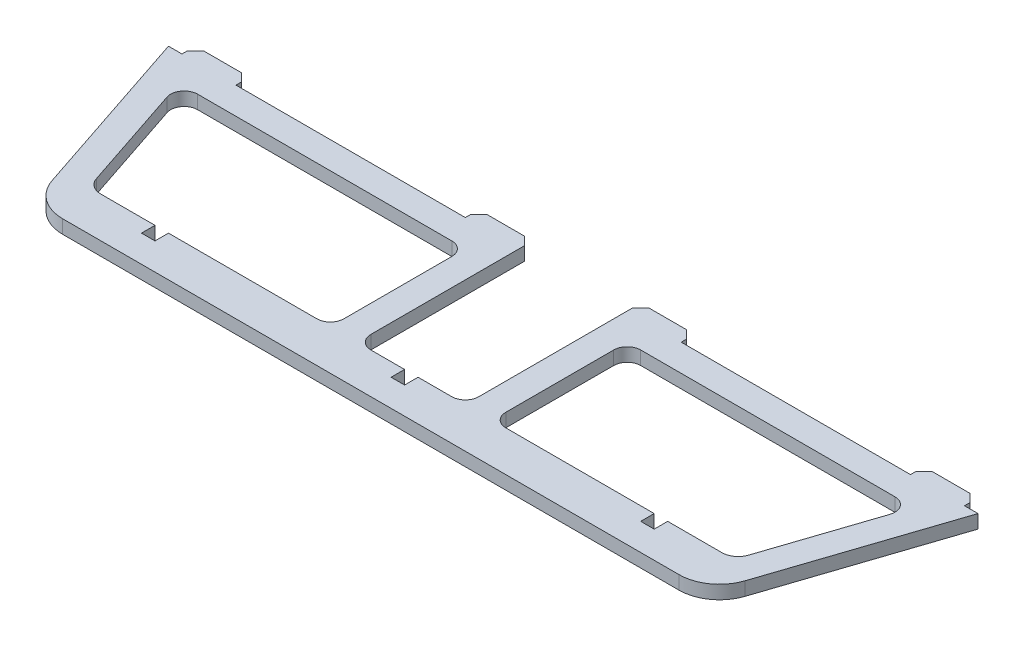
from build123d import *

# Parameters (mm, degrees)
DODANIE_WYCI_GNI_CIE1_DEPTH = 5


with BuildPart() as part:
    # Szkic2 → Dodanie-wyciągnięcie1 (new body)
    with BuildSketch(Plane(origin=(0, 0, 0), x_dir=(1, 0, 0), z_dir=(0, 1, 0))):
        with BuildLine():
            Line((-233.203326012, -150.458299018), (-461.58054941, -150.458299018))
            ThreePointArc((-461.58054941, -150.458299018), (-470.35120368, -147.626931795), (-475.810798881, -140.201715508))
            Line((-475.810798881, -140.201715508), (-497.391937711, -75.458299018))
            Line((-497.391937711, -75.458299018), (-492.391937711, -75.458299018))
            Line((-492.391937711, -75.458299018), (-492.391937711, -73.458299018))
            Line((-492.391937711, -73.458299018), (-489.391937711, -70.458299018))
            Line((-489.391937711, -70.458299018), (-475.391937711, -70.458299018))
            Line((-475.391937711, -70.458299018), (-472.391937711, -73.458299018))
            Line((-472.391937711, -73.458299018), (-472.391937711, -75.458299018))
            Line((-472.391937711, -75.458299018), (-387.391937711, -75.458299018))
            Line((-387.391937711, -75.458299018), (-387.391937711, -73.458299018))
            Line((-387.391937711, -73.458299018), (-384.391937711, -70.458299018))
            Line((-384.391937711, -70.458299018), (-370.391937711, -70.458299018))
            Line((-370.391937711, -70.458299018), (-367.391937711, -73.458299018))
            Line((-367.391937711, -73.458299018), (-367.391937711, -130.458299018))
            ThreePointArc((-367.391937711, -130.458299018), (-365.927471617, -133.993832923), (-362.391937711, -135.458299018))
            Line((-362.391937711, -135.458299018), (-349.891937711, -135.458299018))
            Line((-349.891937711, -135.458299018), (-349.891937711, -140.458299018))
            Line((-349.891937711, -140.458299018), (-344.891937711, -140.458299018))
            Line((-344.891937711, -140.458299018), (-344.891937711, -135.458299018))
            Line((-344.891937711, -135.458299018), (-332.391937711, -135.458299018))
            ThreePointArc((-332.391937711, -135.458299018), (-328.856403805, -133.993832923), (-327.391937711, -130.458299018))
            Line((-327.391937711, -130.458299018), (-327.391937711, -73.458299018))
            Line((-327.391937711, -73.458299018), (-324.391937711, -70.458299018))
            Line((-324.391937711, -70.458299018), (-310.391937711, -70.458299018))
            Line((-310.391937711, -70.458299018), (-307.391937711, -73.458299018))
            Line((-307.391937711, -73.458299018), (-307.391937711, -75.458299018))
            Line((-307.391937711, -75.458299018), (-222.391937711, -75.458299018))
            Line((-222.391937711, -75.458299018), (-222.391937711, -73.458299018))
            Line((-222.391937711, -73.458299018), (-219.391937711, -70.458299018))
            Line((-219.391937711, -70.458299018), (-205.391937711, -70.458299018))
            Line((-205.391937711, -70.458299018), (-202.391937711, -73.458299018))
            Line((-202.391937711, -73.458299018), (-202.391937711, -75.458299018))
            Line((-202.391937711, -75.458299018), (-197.391937711, -75.458299018))
            Line((-197.391937711, -75.458299018), (-218.973076541, -140.201715508))
            ThreePointArc((-218.973076541, -140.201715508), (-224.432671742, -147.626931795), (-233.203326012, -150.458299018))
        make_face()
        with BuildLine():
            Line((-312.391937711, -85.458299018), (-218.203326012, -85.458299018))
            ThreePointArc((-218.203326012, -85.458299018), (-214.147115086, -87.534747594), (-213.459909522, -92.039437848))
            Line((-213.459909522, -92.039437848), (-226.565318777, -131.355665614))
            ThreePointArc((-226.565318777, -131.355665614), (-228.749156857, -134.325752129), (-232.257418565, -135.458299018))
            Line((-232.257418565, -135.458299018), (-252.391937711, -135.458299018))
            Line((-252.391937711, -135.458299018), (-252.391937711, -140.458299018))
            Line((-252.391937711, -140.458299018), (-257.391937711, -140.458299018))
            Line((-257.391937711, -140.458299018), (-257.391937711, -135.458299018))
            Line((-257.391937711, -135.458299018), (-312.391937711, -135.458299018))
            ThreePointArc((-312.391937711, -135.458299018), (-315.927471617, -133.993832923), (-317.391937711, -130.458299018))
            Line((-317.391937711, -130.458299018), (-317.391937711, -90.458299018))
            ThreePointArc((-317.391937711, -90.458299018), (-315.927471617, -86.922765112), (-312.391937711, -85.458299018))
        make_face(mode=Mode.SUBTRACT)
        with BuildLine():
            Line((-442.391937711, -140.458299018), (-437.391937711, -140.458299018))
            Line((-437.391937711, -140.458299018), (-437.391937711, -135.458299018))
            Line((-437.391937711, -135.458299018), (-382.391937711, -135.458299018))
            ThreePointArc((-382.391937711, -135.458299018), (-378.856403805, -133.993832923), (-377.391937711, -130.458299018))
            Line((-377.391937711, -130.458299018), (-377.391937711, -90.458299018))
            ThreePointArc((-377.391937711, -90.458299018), (-378.856403805, -86.922765112), (-382.391937711, -85.458299018))
            Line((-382.391937711, -85.458299018), (-476.58054941, -85.458299018))
            ThreePointArc((-476.58054941, -85.458299018), (-480.636760336, -87.534747594), (-481.3239659, -92.039437848))
            Line((-481.3239659, -92.039437848), (-468.218556645, -131.355665614))
            ThreePointArc((-468.218556645, -131.355665614), (-466.034718565, -134.325752129), (-462.526456857, -135.458299018))
            Line((-462.526456857, -135.458299018), (-442.391937711, -135.458299018))
            Line((-442.391937711, -135.458299018), (-442.391937711, -140.458299018))
        make_face(mode=Mode.SUBTRACT)
    extrude(amount=DODANIE_WYCI_GNI_CIE1_DEPTH)


solid = part.part
